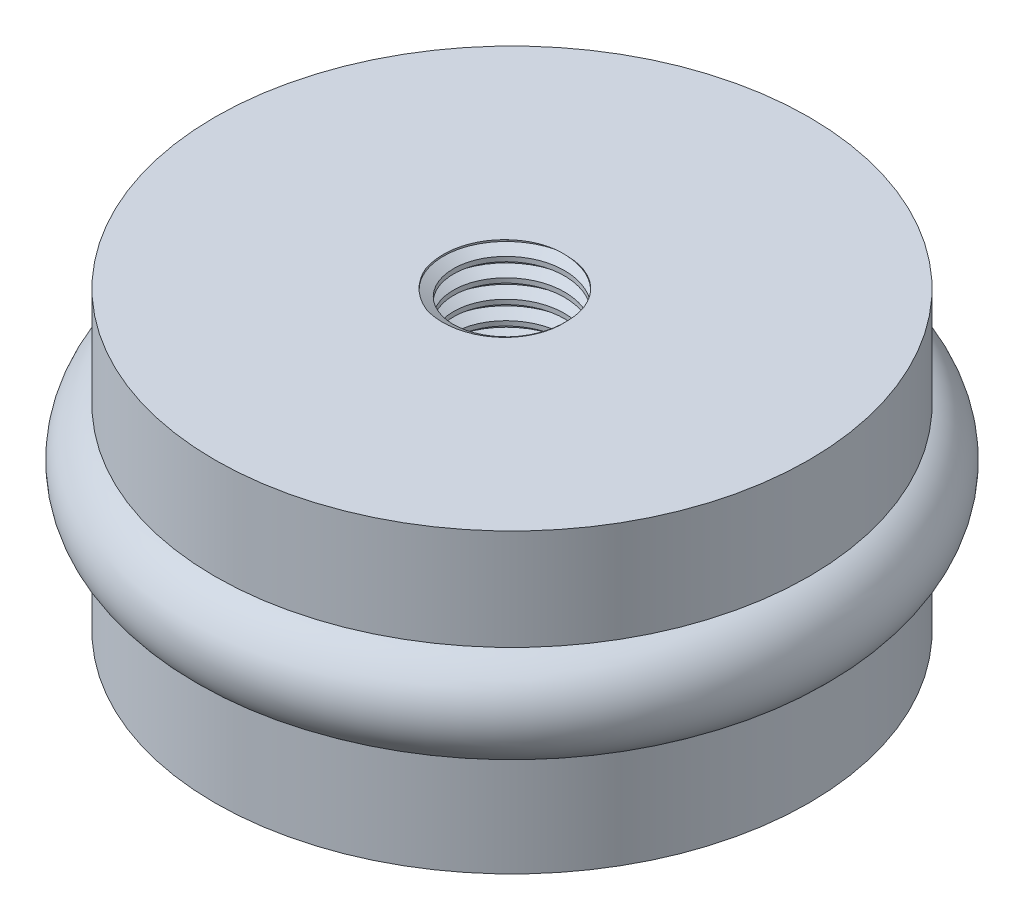
from build123d import *

# Parameters (mm, degrees)
SKETCH14_R              = 6.75
BOSS_EXTRUDE2_DEPTH     = 0.75
SKETCH15_R              = 8
BOSS_EXTRUDE3_DEPTH     = 3.25
SKETCH16_R              = 1.375
SKETCH16_R_2            = 0.375
SKETCH16_W              = 1
SKETCH16_H              = 5.825908645
CUT_EXTRUDE1_DEPTH      = 15.89169437
CUT_EXTRUDE1_DEPTH_BACK = 15.89169437
SKETCH20_R              = 1.5
THREAD1_PITCH           = 0.5


with BuildPart() as part:
    # Sketch14 → Boss-Extrude2 (new, symmetric)
    with BuildSketch(Plane(origin=(0, 0, 0), x_dir=(1, 0, 0), z_dir=(0, 1, 0))):
        with Locations(Location((0, 0, 0), (0, 0, 270))):
            Circle(SKETCH14_R)
    extrude(amount=BOSS_EXTRUDE2_DEPTH, both=True)

    # Sketch15 → Boss-Extrude3 (add)
    with BuildSketch(Plane(origin=(0, 0.75, 0), x_dir=(1, 0, 0), z_dir=(0, 1, 0))):
        with Locations(Location((0, 0, 0), (0, 0, 90))):
            Circle(SKETCH15_R)
    boss_extrude3 = extrude(amount=BOSS_EXTRUDE3_DEPTH)

    # Mirror1: Boss-Extrude3 across plane
    add(boss_extrude3.mirror(Plane.ZX))

    # Sketch16 → Revolve-Thin9 (revolve)
    with BuildSketch(Plane.XY, mode=Mode.PRIVATE) as revolve_thin9_sk:
        with Locations((-7.506513319, 0)):
            Circle(SKETCH16_R)
        with Locations((-7.506513319, 0)):
            Circle(SKETCH16_R_2, mode=Mode.SUBTRACT)
        with Locations((-0.5, 1.087045677)):
            Rectangle(SKETCH16_W, SKETCH16_H)
    revolve(revolve_thin9_sk.sketch.rotate(Axis((0, 4, 0), (0, -1, 0)), 270), axis=Axis((0, 4, 0), (0, -1, 0)))

    # Sketch20 → Cut-Extrude1 (cut, two sides: drawn at the far end of the back side and taken through both)
    with BuildSketch(Plane(origin=(0, 4, 0), x_dir=(1, 0, 0), z_dir=(0, 1, 0)).offset(-CUT_EXTRUDE1_DEPTH_BACK)):
        with Locations(Location((0, 0, 0), (0, 0, 270))):
            Circle(SKETCH20_R)
    extrude(amount=CUT_EXTRUDE1_DEPTH + CUT_EXTRUDE1_DEPTH_BACK, mode=Mode.SUBTRACT)

    # Thread1: the profile of Thread Profile1 profile screwed along a right-hand helix of 16 turns, 6 arcs to a turn; built about Z, then put on its axis
    thread1_z = Axis((0, 0, 0), (0, 0, 1))
    thread1_corners = [(1.4997, 0, -0.000173205), (1.770632937, 0, 0.156249999), (1.770632937, 0, 0.218749999), (1.4997, 0, 0.375173204)]
    with BuildLine(mode=Mode.PRIVATE) as thread1_profile:
        Line(thread1_corners[0], thread1_corners[1])
        Line(thread1_corners[1], thread1_corners[2])
        Line(thread1_corners[2], thread1_corners[3])
        Line(thread1_corners[3], thread1_corners[0])
    thread1_cap = Face(thread1_profile.wire())
    thread1_turn_angles = [0, 30, 60, 90, 120, 150, 180, 210, 240, 270, 300, 330, 360]
    thread1_turn_weights = [1, 0.8660254037844387, 1, 0.8660254037844387, 1, 0.8660254037844387, 1, 0.8660254037844387, 1, 0.8660254037844387, 1, 0.8660254037844387, 1]
    thread1_turn_rails = [Edge.make_bspline([Vector(p[0], p[1], 0).rotate(thread1_z, thread1_turn_angles[k]) / thread1_turn_weights[k] + Vector(0, 0, p[2] + THREAD1_PITCH * thread1_turn_angles[k] / 360) for k in range(13)], [0, 0, 0, 1, 1, 2, 2, 3, 3, 4, 4, 5, 5, 6, 6, 6], 2, thread1_turn_weights) for p in thread1_corners]
    thread1_turn_sides = [Face.make_surface_from_curves(thread1_turn_rails[p[0]], thread1_turn_rails[p[1]]) for p in [(0, 1), (1, 2), (2, 3), (3, 0)]]
    thread1 = Plane(origin=(0, -4, 0), x_dir=(1, 0, 0), z_dir=(0, 1, 0)) * Solid(Shell([*[p.moved(Location((0, 0, THREAD1_PITCH * i))) for i in range(16) for p in thread1_turn_sides], thread1_cap, thread1_cap.rotate(thread1_z, 5760).moved(Location((0, 0, THREAD1_PITCH * 5760 / 360)))]))
    add(thread1, mode=Mode.SUBTRACT)


solid = part.part
